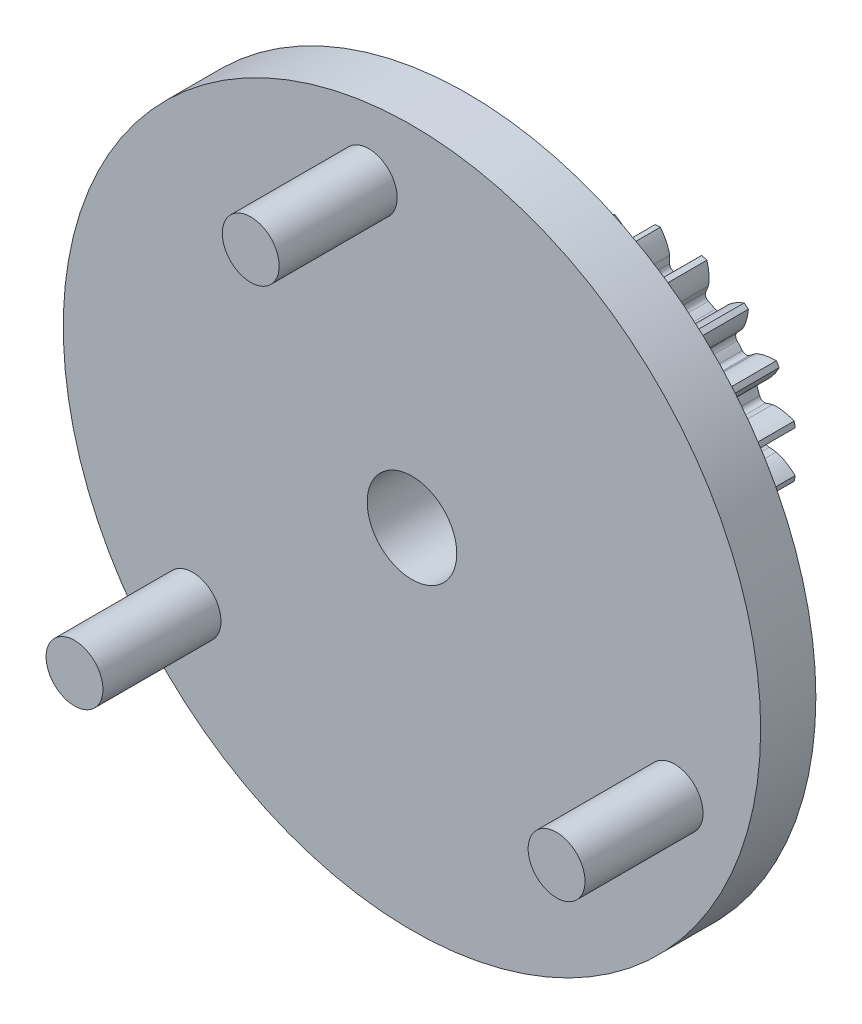
from build123d import *

# Parameters (mm, degrees)
BLANK_SKETCH_R      = 11.875
BLANK_DEPTH         = 5
TOOTH_SPACE_DEPTH   = 18.522307211
TEETH_COUNT         = 17
BORE_DEPTH          = 18.502023289
BORE_DEPTH_BACK     = 18.502023289
BORE_SKETCH_R       = 4.175
SKETCH1_R           = 32.5
SKETCH1_R_2         = 2.65
SKETCH1_R_3         = 4.175
BOSS_EXTRUDE1_DEPTH = 5
BOSS_EXTRUDE2_START = 14
SKETCH3_R           = 8.75
SKETCH3_R_2         = 4.175
BOSS_EXTRUDE2_DEPTH = 14
CHAMFER2_SIZE       = 13.856406461
CHAMFER2_SIZE_2     = 24
SKETCH1_5_R         = 2.65
BOSS_EXTRUDE3_DEPTH = 11
CIRPATTERN1_COUNT   = 3


with BuildPart() as part:
    # Blank Sketch → Blank (new body)
    with BuildSketch(Plane.XY):
        Circle(BLANK_SKETCH_R)
    extrude(amount=BLANK_DEPTH)

    # Tooth Space Sketch → Tooth Space (cut, symmetric)
    with BuildSketch(Plane.XY):
        with BuildLine():
            Line((9.942364801, 0.91340716), (9.298767719, 0.854279759))
            ThreePointArc((9.298767719, 0.854279759), (8.984863997, 0.694192597), (8.867618155, 0.361902274))
            ThreePointArc((8.867618155, 0.361902274), (8.875, 0), (8.867618155, -0.361902274))
            ThreePointArc((8.867618155, -0.361902274), (8.984863997, -0.694192597), (9.298767719, -0.854279759))
            Line((9.298767719, -0.854279759), (9.942364801, -0.91340716))
            add(Edge.make_bspline(
                [(9.942364801, -0.91340716), (9.947707774, -0.913995463), (9.962658326, -0.915943937), (9.990773403, -0.92080477), (10.03637124, -0.930398576), (10.094010888, -0.945054989), (10.167889919, -0.966771469), (10.254035794, -0.995895766), (10.347670082, -1.031581288), (10.448308522, -1.074335805), (10.547535018, -1.120434221), (10.645345427, -1.169591339), (10.74167088, -1.221399901), (10.856958299, -1.28747082), (10.993207383, -1.371281114), (11.149344102, -1.475798759), (11.322581132, -1.601986981), (11.494732709, -1.73857283), (11.660412139, -1.879471881), (11.823262512, -2.029086969), (11.977584919, -2.17897923), (12.132897457, -2.341825663), (12.273746711, -2.495808162), (12.42574568, -2.675962445), (12.546739308, -2.823606943), (12.666700658, -2.982295404), (12.724336253, -3.060430467), (12.753472124, -3.10073762)],
                knots=[0, 0, 0, 0, 0, 0.005376748, 0.015083688, 0.02853182, 0.046610139, 0.064854849, 0.092110525, 0.119476176, 0.146842495, 0.174208854, 0.201574955, 0.228941013, 0.256307345, 0.307035032, 0.361767351, 0.41649966, 0.471231936, 0.525964282, 0.580696615, 0.635428982, 0.690161387, 0.744893688, 0.799626082, 0.854358408, 0.909090915, 0.909090915, 0.909090915, 0.909090915, 0.909090915], degree=4))
            Line((12.753472124, -3.10073762), (12.753472124, 3.10073762))
            add(Edge.make_bspline(
                [(9.942364801, 0.91340716), (9.947707774, 0.913995463), (9.962658326, 0.915943937), (9.990773403, 0.92080477), (10.03637124, 0.930398576), (10.094010888, 0.945054989), (10.167889919, 0.966771469), (10.254035794, 0.995895766), (10.347670082, 1.031581288), (10.448308522, 1.074335805), (10.547535018, 1.120434221), (10.645345427, 1.169591339), (10.74167088, 1.221399901), (10.856958299, 1.28747082), (10.993207383, 1.371281114), (11.149344102, 1.475798759), (11.322581132, 1.601986981), (11.494732709, 1.73857283), (11.660412139, 1.879471881), (11.823262512, 2.029086969), (11.977584919, 2.17897923), (12.132897457, 2.341825663), (12.273746711, 2.495808162), (12.42574568, 2.675962445), (12.546739308, 2.823606943), (12.666700658, 2.982295404), (12.724336253, 3.060430467), (12.753472124, 3.10073762)],
                knots=[0, 0, 0, 0, 0, 0.005376748, 0.015083688, 0.02853182, 0.046610139, 0.064854849, 0.092110525, 0.119476176, 0.146842495, 0.174208854, 0.201574955, 0.228941013, 0.256307345, 0.307035032, 0.361767351, 0.41649966, 0.471231936, 0.525964282, 0.580696615, 0.635428982, 0.690161387, 0.744893688, 0.799626082, 0.854358408, 0.909090915, 0.909090915, 0.909090915, 0.909090915, 0.909090915], degree=4))
        make_face()
    tooth_space = extrude(amount=TOOTH_SPACE_DEPTH, both=True, mode=Mode.SUBTRACT)

    # Teeth: Tooth Space ×17 about axis
    teeth_axis = Axis((0, 0, -1.75006405), (0, 0, 1))
    for i in range(1, TEETH_COUNT):
        add(tooth_space.rotate(teeth_axis, i * 360 / TEETH_COUNT), mode=Mode.SUBTRACT)

    # Bore Sketch → Bore (cut, two sides: drawn at the far end of the back side and taken through both)
    with BuildSketch(Plane.XY.offset(-BORE_DEPTH_BACK)):
        Circle(BORE_SKETCH_R)
    extrude(amount=BORE_DEPTH + BORE_DEPTH_BACK, mode=Mode.SUBTRACT)



with BuildPart() as body_2:
    # Sketch1 → Boss-Extrude1 (new body)
    # profile 1 of 2: a face of its own
    with BuildSketch(Plane.XY.offset(24)):
        Circle(SKETCH1_R)
        with Locations((-4.02653094, 25.939343642)):
            Circle(SKETCH1_R_2, mode=Mode.SUBTRACT)
        Circle(SKETCH1_R_3, mode=Mode.SUBTRACT)
    # profile 2 of 2: a face of its own
    with BuildSketch(Plane.XY.offset(24)):
        with Locations((-4.02653094, 25.939343642)):
            Circle(SKETCH1_R_2)
    extrude(amount=-BOSS_EXTRUDE1_DEPTH)


with BuildPart() as part_1:
    add(part.part)

    add(body_2.part)  # Boss-Extrude2 merges body 2
    # Sketch3 → Boss-Extrude2 (add)
    with BuildSketch(Plane(origin=(0, 0, 19), x_dir=(-1, 0, 0), z_dir=(0, 0, -1)).offset(BOSS_EXTRUDE2_START)):
        with Locations(Location((0, 0, 0), (0, 0, 180))):
            Circle(SKETCH3_R)
        with Locations(Location((0, 0, 0), (0, 0, 180))):
            Circle(SKETCH3_R_2, mode=Mode.SUBTRACT)
    extrude(amount=-BOSS_EXTRUDE2_DEPTH)

    # Chamfer2
    # the kernel refuses this chamfer: 24, 13.856406461 mm, written as the material it adds along each edge
    with BuildSketch(Plane(origin=(0, 0, 19), x_dir=(1, 0, 0), z_dir=(0, 1, 0))) as chamfer2_piece_1_section:
        Polygon((8.75, CHAMFER2_SIZE), (8.75 + CHAMFER2_SIZE_2, 0), (8.75, 0), align=None)
    chamfer2_piece_1 = revolve(axis=Axis((0, 0, 19), (0, 0, -1)), mode=Mode.PRIVATE)
    chamfer2_piece_1 = chamfer2_piece_1 & Plane(origin=(0, 0, 11.993735061), x_dir=(1, 0, 0), z_dir=(0, 0, 1)) * Cylinder(32.5, 131, mode=Mode.PRIVATE)
    add(chamfer2_piece_1)

    # Sketch1<5> → Boss-Extrude3 (add)
    with BuildSketch(Plane.XY.offset(24)):
        with Locations((-4.02653094, 25.939343642)):
            Circle(SKETCH1_5_R)
    boss_extrude3 = extrude(amount=BOSS_EXTRUDE3_DEPTH)

    # CirPattern1: Boss-Extrude3 ×3 about axis
    cirpattern1_axis = Axis((0, 0, 0), (0, 0, 1))
    for i in range(1, CIRPATTERN1_COUNT):
        add(boss_extrude3.rotate(cirpattern1_axis, i * 360 / CIRPATTERN1_COUNT))


solid = part_1.part
